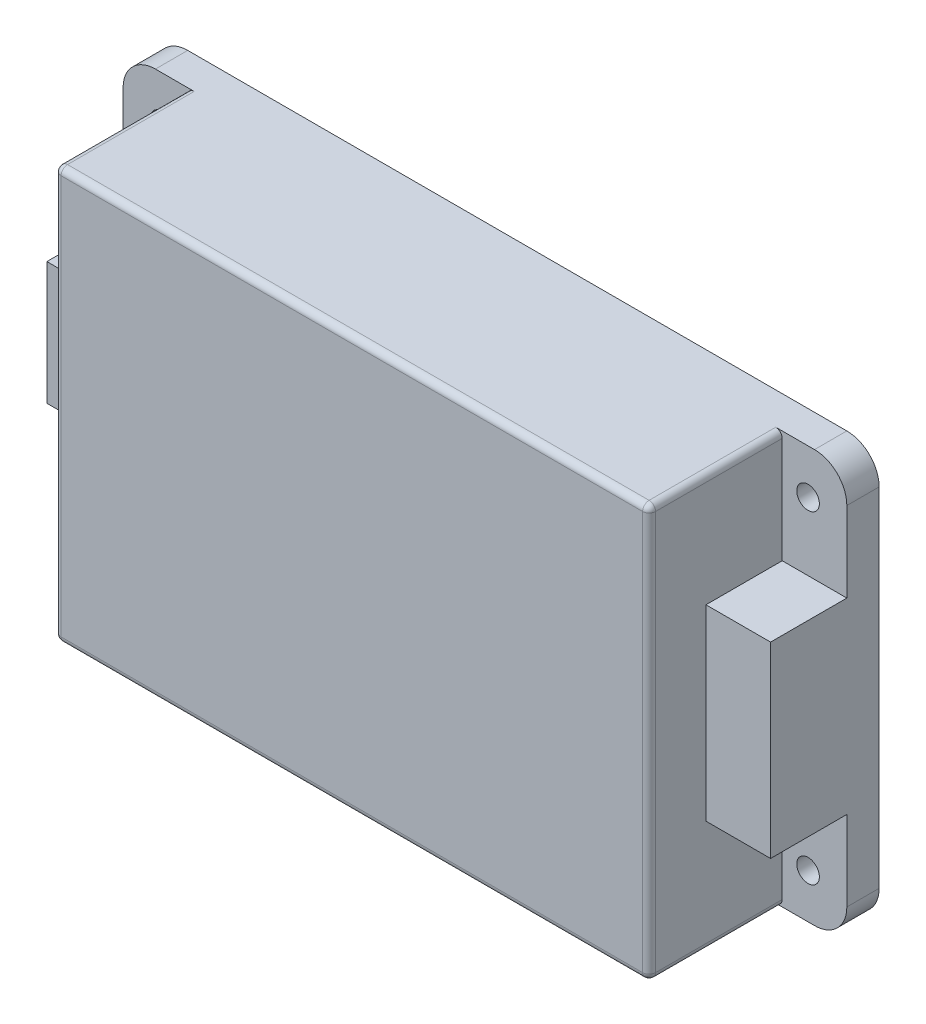
from build123d import *

# Parameters (mm, degrees)
SKETCH1_W           = 112
SKETCH1_H           = 63.8
SKETCH1_R           = 1.75
BOSS_EXTRUDE1_DEPTH = 5
SKETCH2_W           = 92
SKETCH2_H           = 63.8
BOSS_EXTRUDE2_DEPTH = 20.6
SKETCH3_W           = 10
SKETCH3_H           = 19
SKETCH3_H_2         = 29
BOSS_EXTRUDE3_DEPTH = 11.8
FILLET1_R           = 5
FILLET2_R           = 1
FILLET3_R           = 1


with BuildPart() as part:
    # Sketch1 → Boss-Extrude1 (new body)
    with BuildSketch(Plane.XY):
        with Locations((-56, 31.9)):
            Rectangle(SKETCH1_W, SKETCH1_H)
        with Locations((-106, 56.9)):
            Circle(SKETCH1_R, mode=Mode.SUBTRACT)
        with Locations(Location((-6, 56.9, 0), (0, 0, 180))):
            Circle(SKETCH1_R, mode=Mode.SUBTRACT)
        with Locations((-6, 6.9)):
            Circle(SKETCH1_R, mode=Mode.SUBTRACT)
        with Locations(Location((-106, 6.9, 0), (0, 0, 180))):
            Circle(SKETCH1_R, mode=Mode.SUBTRACT)
    extrude(amount=BOSS_EXTRUDE1_DEPTH)

    # Sketch2 → Boss-Extrude2 (add)
    with BuildSketch(Plane.XY.offset(5)):
        with Locations((-56, 31.9)):
            Rectangle(SKETCH2_W, SKETCH2_H)
    extrude(amount=BOSS_EXTRUDE2_DEPTH)

    # Sketch3 → Boss-Extrude3 (add)
    with BuildSketch(Plane.XY.offset(5)):
        with Locations((-107, 31.9)):
            Rectangle(SKETCH3_W, SKETCH3_H)
        with Locations((-5, 31.9)):
            Rectangle(SKETCH3_W, SKETCH3_H_2)
    extrude(amount=BOSS_EXTRUDE3_DEPTH)

    # Fillet1
    fillet1_edges = [part.edges().sort_by_distance(p)[0] for p in [
        (0, 0, 2.5),
        (-112, 0, 2.5),
        (-112, 63.8, 2.5),
        (0, 63.8, 2.5),
    ]]
    fillet(fillet1_edges, radius=FILLET1_R)

    # Fillet2
    fillet2_edges = [part.edges().sort_by_distance(p)[0] for p in [
        (-102, 31.9, 25.6),
        (-56, 0, 25.6),
        (-10, 31.9, 25.6),
        (-56, 63.8, 25.6),
    ]]
    fillet(fillet2_edges, radius=FILLET2_R)

    # Fillet3
    # the kernel refuses this fillet: 1 mm, written as the material it takes off along each edge
    with BuildSketch(Plane(origin=(-11, 1, 24.6), x_dir=(1, 0, 0), z_dir=(0, -1, 0))) as fillet3_piece_1_section:
        Polygon((0, 0), (FILLET3_R, 0), (FILLET3_R, FILLET3_R), (0, FILLET3_R), align=None)
    fillet3_piece_1 = extrude(amount=FILLET3_R, mode=Mode.PRIVATE)
    fillet3_piece_1 = fillet3_piece_1 - Plane(origin=(-11, 1, 24.6), x_dir=(-0.7071067811865475, 0, -0.7071067811865475), z_dir=(0, -1, 0)) * Sphere(FILLET3_R, mode=Mode.PRIVATE)
    add(fillet3_piece_1, mode=Mode.SUBTRACT)
    with BuildSketch(Plane(origin=(-101, 1, 24.6), x_dir=(-1, 0, 0), z_dir=(0, -1, 0))) as fillet3_piece_2_section:
        Polygon((0, 0), (FILLET3_R, 0), (FILLET3_R, -FILLET3_R), (0, -FILLET3_R), align=None)
    fillet3_piece_2 = extrude(amount=FILLET3_R, mode=Mode.PRIVATE)
    fillet3_piece_2 = fillet3_piece_2 - Plane(origin=(-101, 1, 24.6), x_dir=(0.7071067811865475, 0, -0.7071067811865475), z_dir=(0, -1, 0)) * Sphere(FILLET3_R, mode=Mode.PRIVATE)
    add(fillet3_piece_2, mode=Mode.SUBTRACT)
    with BuildSketch(Plane(origin=(-11, 62.8, 24.6), x_dir=(0, 1, 0), z_dir=(1, 0, 0))) as fillet3_piece_3_section:
        Polygon((0, 0), (FILLET3_R, 0), (FILLET3_R, FILLET3_R), (0, FILLET3_R), align=None)
    fillet3_piece_3 = extrude(amount=FILLET3_R, mode=Mode.PRIVATE)
    fillet3_piece_3 = fillet3_piece_3 - Plane(origin=(-11, 62.8, 24.6), x_dir=(0, -0.7071067811865475, -0.7071067811865475), z_dir=(1, 0, 0)) * Sphere(FILLET3_R, mode=Mode.PRIVATE)
    add(fillet3_piece_3, mode=Mode.SUBTRACT)
    with BuildSketch(Plane(origin=(-101, 62.8, 24.6), x_dir=(0, 1, 0), z_dir=(-1, 0, 0))) as fillet3_piece_4_section:
        Polygon((0, 0), (FILLET3_R, 0), (FILLET3_R, -FILLET3_R), (0, -FILLET3_R), align=None)
    fillet3_piece_4 = extrude(amount=FILLET3_R, mode=Mode.PRIVATE)
    fillet3_piece_4 = fillet3_piece_4 - Plane(origin=(-101, 62.8, 24.6), x_dir=(0, -0.7071067811865475, -0.7071067811865475), z_dir=(-1, 0, 0)) * Sphere(FILLET3_R, mode=Mode.PRIVATE)
    add(fillet3_piece_4, mode=Mode.SUBTRACT)
    with BuildSketch(Plane(origin=(-102, 63.8, 5), x_dir=(0, -1, 0), z_dir=(0, 0, 1)), Plane(origin=(-102, 0, 5), x_dir=(1, 0, 0), z_dir=(0, 0, 1))) as fillet3_piece_5:
        with BuildLine():
            CenterArc((FILLET3_R, FILLET3_R), FILLET3_R, 180, 90)
            Line((0, FILLET3_R), (0, 0))
            Line((0, 0), (FILLET3_R, 0))
        make_face()
    extrude(amount=19.6, mode=Mode.SUBTRACT)
    with BuildSketch(Plane(origin=(-10, 63.8, 5), x_dir=(0, -1, 0), z_dir=(0, 0, 1)), Plane(origin=(-10, 0, 5), x_dir=(-1, 0, 0), z_dir=(0, 0, 1))) as fillet3_piece_6:
        with BuildLine():
            CenterArc((FILLET3_R, -FILLET3_R), FILLET3_R, 90, 90)
            Line((0, -FILLET3_R), (0, 0))
            Line((0, 0), (FILLET3_R, 0))
        make_face()
    extrude(amount=19.6, mode=Mode.SUBTRACT)


solid = part.part
